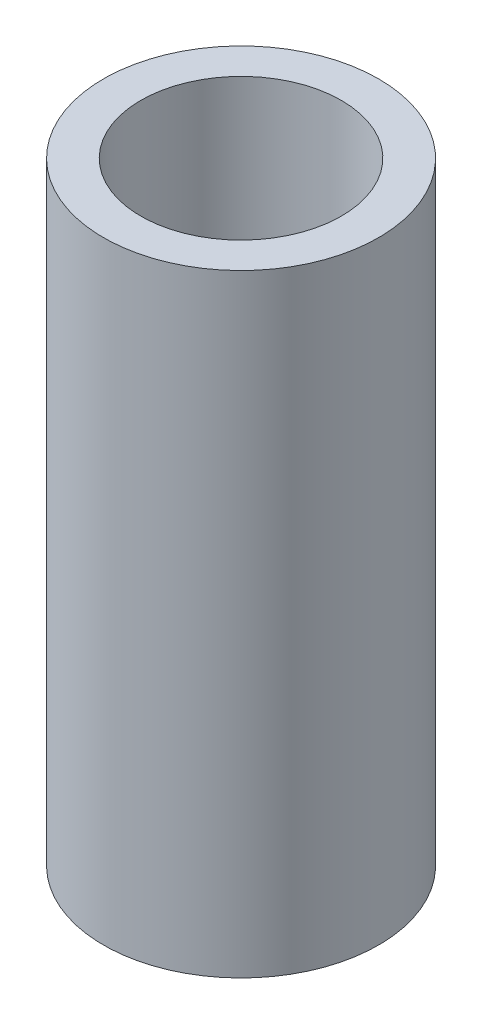
from build123d import *

# Parameters (mm, degrees)
SKETCH1_R           = 25
BOSS_EXTRUDE1_DEPTH = 111.352511532
SKETCH2_R           = 18.22826721
CUT_EXTRUDE1_DEPTH  = 117.830568879


with BuildPart() as part:
    # Sketch1 → Boss-Extrude1 (new body)
    with BuildSketch(Plane(origin=(0, 0, 0), x_dir=(1, 0, 0), z_dir=(0, 1, 0))):
        Circle(SKETCH1_R)
    extrude(amount=BOSS_EXTRUDE1_DEPTH)

    # Sketch2 → Cut-Extrude1 (cut, through all)
    with BuildSketch(Plane(origin=(0, 0, 0), x_dir=(1, 0, 0), z_dir=(0, 1, 0))):
        Circle(SKETCH2_R)
    extrude(amount=CUT_EXTRUDE1_DEPTH, mode=Mode.SUBTRACT)


solid = part.part
